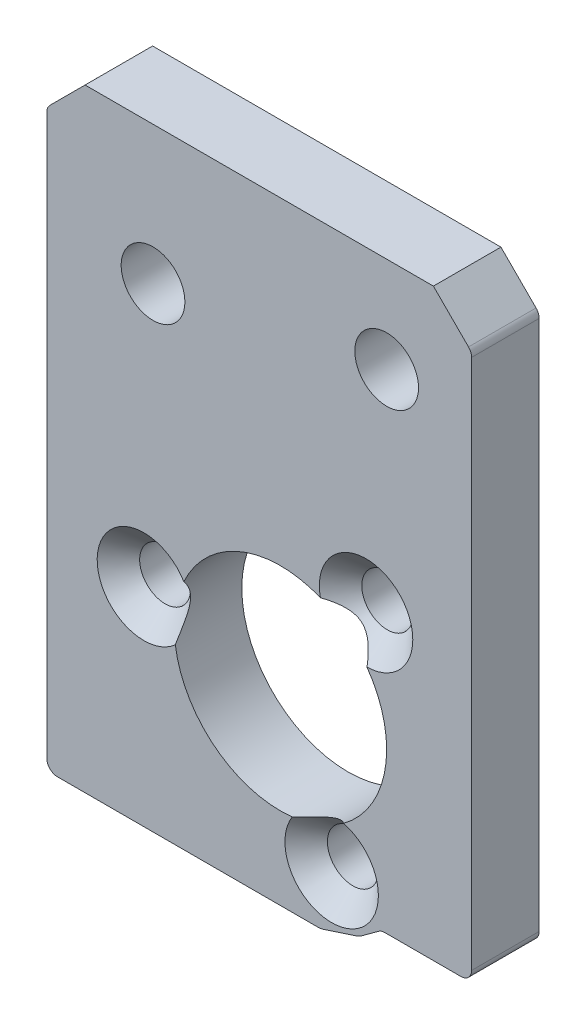
from build123d import *

# Parameters (mm, degrees)
SKETCH1_W                                       = 20
SKETCH1_H                                       = 29.11
SKETCH1_R                                       = 5
SKETCH1_R_2                                     = 1.5
SKETCH1_R_3                                     = 1.2
BOSS_EXTRUDE2_DEPTH                             = 3.18
CSK_FOR_M2_FLAT_HEAD_MACHINE_SCREW1_D           = 2.4
CSK_FOR_M2_FLAT_HEAD_MACHINE_SCREW1_DEPTH       = 3.508967257
CSK_FOR_M2_FLAT_HEAD_MACHINE_SCREW1_CSINK_D     = 4.4
CSK_FOR_M2_FLAT_HEAD_MACHINE_SCREW1_CSINK_ANGLE = 90
CSK_FOR_M2_FLAT_HEAD_MACHINE_SCREW1_TIP         = 0.721032743
CHAMFER1_SIZE                                   = 1.8
FILLET1_R                                       = 0.5
CUT_EXTRUDE1_DEPTH                              = 4
FILLET6_R                                       = 0.5
CUT_EXTRUDE2_DEPTH                              = 4
FILLET8_R                                       = 1


with BuildPart() as part:
    # Sketch1 → Boss-Extrude2 (new body)
    with BuildSketch(Plane.XY):
        with Locations((10, 14.555)):
            Rectangle(SKETCH1_W, SKETCH1_H)
        with Locations((11, 9.11)):
            Circle(SKETCH1_R, mode=Mode.SUBTRACT)
        with Locations((5, 22.61)):
            Circle(SKETCH1_R_2, mode=Mode.SUBTRACT)
        with Locations((16, 24.61)):
            Circle(SKETCH1_R_2, mode=Mode.SUBTRACT)
        with Locations((15.03, 14.21)):
            Circle(SKETCH1_R_3, mode=Mode.SUBTRACT)
        with Locations((4.57, 10.04)):
            Circle(SKETCH1_R_3, mode=Mode.SUBTRACT)
        with Locations((13.41, 2.96)):
            Circle(SKETCH1_R_3, mode=Mode.SUBTRACT)
    extrude(amount=-BOSS_EXTRUDE2_DEPTH)

    # CSK for M2 Flat Head Machine Screw1
    with Locations(Plane.XY):
        with Locations((4.57, 10.04), (15.03, 14.21), (13.41, 2.96)):
            CounterSinkHole(CSK_FOR_M2_FLAT_HEAD_MACHINE_SCREW1_D / 2, CSK_FOR_M2_FLAT_HEAD_MACHINE_SCREW1_CSINK_D / 2, depth=CSK_FOR_M2_FLAT_HEAD_MACHINE_SCREW1_DEPTH, counter_sink_angle=CSK_FOR_M2_FLAT_HEAD_MACHINE_SCREW1_CSINK_ANGLE)
            with Locations((0, 0, -(CSK_FOR_M2_FLAT_HEAD_MACHINE_SCREW1_DEPTH + CSK_FOR_M2_FLAT_HEAD_MACHINE_SCREW1_TIP / 2))):  # 118° drill point
                Cone(0, CSK_FOR_M2_FLAT_HEAD_MACHINE_SCREW1_D / 2, CSK_FOR_M2_FLAT_HEAD_MACHINE_SCREW1_TIP, mode=Mode.SUBTRACT)

    # Chamfer1
    chamfer1_edges = [part.edges().sort_by_distance(p)[0] for p in [
        (0, 29.11, -1.59),
        (20, 29.11, -1.59),
    ]]
    chamfer(chamfer1_edges, length=CHAMFER1_SIZE)

    # Fillet1
    fillet1_edges = [part.edges().sort_by_distance(p)[0] for p in [
        (20, 27.31, -1.59),
        (0, 27.31, -1.59),
    ]]
    fillet(fillet1_edges, radius=FILLET1_R)

    # Sketch12 → Cut-Extrude1 (cut)
    with BuildSketch(Plane(origin=(0, 0, -3.18), x_dir=(-1, 0, 0), z_dir=(0, 0, -1))):
        Polygon((0, 0), (-20, 0), (-20, 1.60680291), (-15.748577863, 1.60680291), (-13.898929975, 0.251358625), (0, 0.251358625), align=None)
    extrude(amount=-CUT_EXTRUDE1_DEPTH, mode=Mode.SUBTRACT)

    # Fillet6
    fillet6_edges = [part.edges().sort_by_distance(p)[0] for p in [
        (0, 0.251358625, -1.59),
        (15.748577863, 1.60680291, -1.59),
        (20, 1.60680291, -1.59),
    ]]
    fillet(fillet6_edges, radius=FILLET6_R)

    # Sketch14 → Cut-Extrude2 (cut)
    with BuildSketch(Plane.XY):
        Polygon((12.898929975, 0.251358625), (13.898929975, 0.251358625), (14.705535433, 0.842448835), align=None)
    extrude(amount=-CUT_EXTRUDE2_DEPTH, mode=Mode.SUBTRACT)

    # Fillet8
    fillet8_edges = [part.edges().sort_by_distance(p)[0] for p in [
        (12.898929975, 0.251358625, -1.59),
        (14.705535433, 0.842448835, -1.59),
    ]]
    fillet(fillet8_edges, radius=FILLET8_R)


solid = part.part
